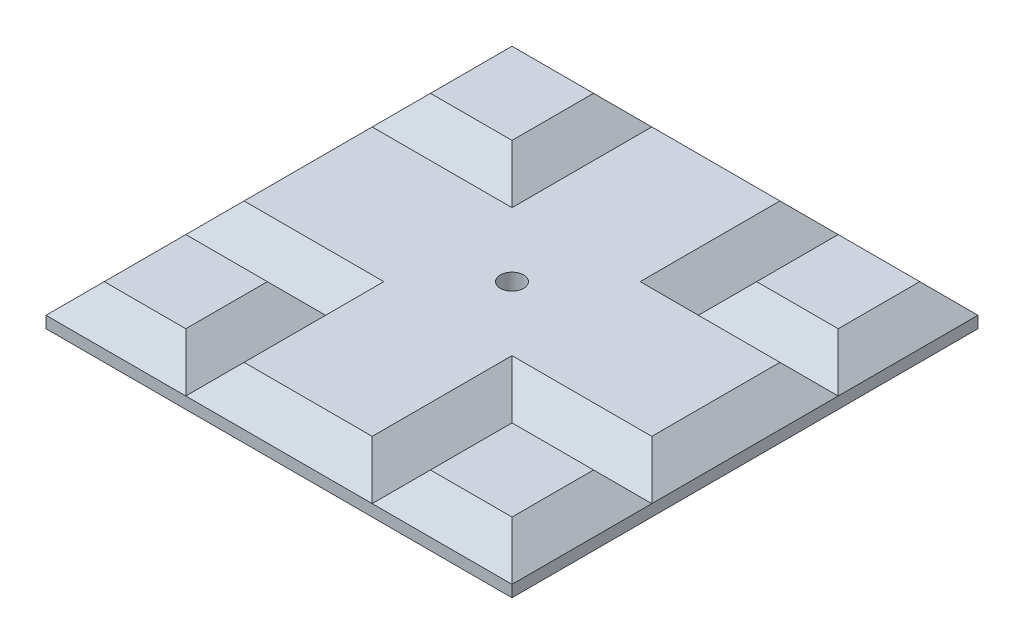
from build123d import *

# Parameters (mm, degrees)
SKETCH1_W           = 40
SKETCH1_H           = 40
BOSS_EXTRUDE1_DEPTH = 6
SKETCH2_W           = 12
SKETCH2_H           = 12
CUT_EXTRUDE1_DEPTH  = 2.5
SKETCH3_W           = 12
SKETCH3_H           = 12
CUT_EXTRUDE2_DEPTH  = 2.5
CHAMFER1_SIZE       = 2.5
SKETCH4_W           = 12
SKETCH4_H           = 12
BOSS_EXTRUDE2_DEPTH = 2.5
SKETCH5_W           = 12
SKETCH5_H           = 12
BOSS_EXTRUDE3_DEPTH = 2.5
CHAMFER2_SIZE       = 2.5
SKETCH6_R           = 2.5
CUT_EXTRUDE3_DEPTH  = 2.5
SKETCH7_R           = 1
CUT_EXTRUDE4_DEPTH  = 29.91366459


# Some blends are built 0.0001 mm under size
with BuildPart() as part:
    # Sketch1 → Boss-Extrude1 (new body)
    with BuildSketch(Plane(origin=(0, 0, 0), x_dir=(1, 0, 0), z_dir=(0, 1, 0))):
        Rectangle(SKETCH1_W, SKETCH1_H)
    extrude(amount=BOSS_EXTRUDE1_DEPTH)

    # Sketch2 → Cut-Extrude1 (cut)
    with BuildSketch(Plane.XZ):
        with Locations((14, 14)):
            Rectangle(SKETCH2_W, SKETCH2_H)
        with Locations((-14, 14)):
            Rectangle(SKETCH2_W, SKETCH2_H)
        with Locations((14, -14)):
            Rectangle(SKETCH2_W, SKETCH2_H)
        with Locations((-14, -14)):
            Rectangle(SKETCH2_W, SKETCH2_H)
    extrude(amount=-CUT_EXTRUDE1_DEPTH, mode=Mode.SUBTRACT)

    # Sketch3 → Cut-Extrude2 (cut)
    with BuildSketch(Plane(origin=(0, 6, 0), x_dir=(1, 0, 0), z_dir=(0, 1, 0))):
        with Locations((14, 14)):
            Rectangle(SKETCH3_W, SKETCH3_H)
        with Locations((-14, 14)):
            Rectangle(SKETCH3_W, SKETCH3_H)
        with Locations((14, -14)):
            Rectangle(SKETCH3_W, SKETCH3_H)
        with Locations((-14, -14)):
            Rectangle(SKETCH3_W, SKETCH3_H)
    extrude(amount=-CUT_EXTRUDE2_DEPTH, mode=Mode.SUBTRACT)

    # Chamfer1
    chamfer1_edges = [part.edges().sort_by_distance(p)[0] for p in [
        (-14, 6, -8),
        (-8, 6, -14),
        (0, 6, -20),
        (8, 6, -14),
        (14, 6, -8),
        (20, 6, 0),
        (14, 6, 8),
        (8, 6, 14),
        (0, 6, 20),
        (-8, 6, 14),
        (-14, 6, 8),
        (-20, 6, 0),
        (-20, 0, 0),
        (-14, 0, 8),
        (-8, 0, 14),
        (0, 0, 20),
        (8, 0, 14),
        (14, 0, 8),
        (20, 0, 0),
        (14, 0, -8),
        (8, 0, -14),
        (0, 0, -20),
        (-8, 0, -14),
        (-14, 0, -8),
    ]]
    chamfer(chamfer1_edges, length=CHAMFER1_SIZE - 0.0001)  # a hair under: the kernel refuses the full size

    # Sketch4 → Boss-Extrude2 (add)
    with BuildSketch(Plane.XZ.offset(-2.5)):
        with Locations((14, -14)):
            Rectangle(SKETCH4_W, SKETCH4_H)
        with Locations((14, 14)):
            Rectangle(SKETCH4_W, SKETCH4_H)
        with Locations((-14, -14)):
            Rectangle(SKETCH4_W, SKETCH4_H)
        with Locations((-14, 14)):
            Rectangle(SKETCH4_W, SKETCH4_H)
    extrude(amount=BOSS_EXTRUDE2_DEPTH)

    # Sketch5 → Boss-Extrude3 (add)
    with BuildSketch(Plane(origin=(0, 3.5, 0), x_dir=(1, 0, 0), z_dir=(0, 1, 0))):
        with Locations((-14, -14)):
            Rectangle(SKETCH5_W, SKETCH5_H)
        with Locations((14, -14)):
            Rectangle(SKETCH5_W, SKETCH5_H)
        with Locations((-14, 14)):
            Rectangle(SKETCH5_W, SKETCH5_H)
        with Locations((14, 14)):
            Rectangle(SKETCH5_W, SKETCH5_H)
    extrude(amount=BOSS_EXTRUDE3_DEPTH)

    # Chamfer2
    # the kernel refuses this chamfer: 2.5 mm, written as the material it takes off along each edge
    with BuildSketch(Plane(origin=(8, 6, 8), x_dir=(0, -0.9996219169112968, -0.027495876610586317), z_dir=(1, 0, 0)), Plane(origin=(-26.42920747, 0, -8), x_dir=(0, 0.9996219169112968, 0.027495876610586317), z_dir=(1, 0, 0)), Plane(origin=(-8, 0, 8), x_dir=(0, 0.9996219169112968, -0.027495876610586317), z_dir=(-1, 0, 0)), Plane(origin=(-26.42920747, 6, -8), x_dir=(6.9547671466025935e-15, 0.027495876610586317, -0.9996219169112968), z_dir=(1, 0, 0))) as chamfer2_piece_1:
        Polygon((CHAMFER2_SIZE * 0.999621916911, -CHAMFER2_SIZE * 0.0274958766106), (-CHAMFER2_SIZE * 0.0274958766106, -CHAMFER2_SIZE * 0.999621916911), (0, 0), align=None)
    extrude(amount=18.42920747, mode=Mode.SUBTRACT)
    with BuildSketch(Plane(origin=(20, 6, 1.57079253), x_dir=(0.027495876610586317, -0.9996219169112968, -1.2780451150309794e-15), z_dir=(0, 0, 1)), Plane(origin=(26.42920747, 6, 20), x_dir=(0, -0.9996219169112968, 0.027495876610586317), z_dir=(-1, 0, 0)), Plane(origin=(-20, 0, 1.57079253), x_dir=(-0.027495876610586317, 0.9996219169112968, 0), z_dir=(0, 0, 1)), Plane(origin=(-26.42920747, 0, 20), x_dir=(0, 0.9996219169112968, 0.027495876610586317), z_dir=(1, 0, 0)), Plane(origin=(20, 0, 1.57079253), x_dir=(-0.9996219169112968, -0.027495876610586372, 0), z_dir=(0, 0, 1)), Plane(origin=(26.42920747, 0, -20), x_dir=(0, 0.9996219169112968, -0.027495876610586317), z_dir=(-1, 0, 0)), Plane(origin=(20, 6, -1.57079253), x_dir=(-0.9996219169112968, 0.027495876610586317, -1.0358163835365089e-14), z_dir=(0, 0, -1)), Plane(origin=(-20, 6, -26.42920747), x_dir=(0.9996219169112968, 0.027495876610586317, -3.936102257438915e-14), z_dir=(0, 0, 1)), Plane(origin=(-20, 6, 1.57079253), x_dir=(0.9996219169112968, 0.027495876610586317, 3.5513704578394593e-15), z_dir=(0, 0, 1))) as chamfer2_piece_2:
        Polygon((CHAMFER2_SIZE * 0.999621916911, -CHAMFER2_SIZE * 0.0274958766106), (-CHAMFER2_SIZE * 0.0274958766106, -CHAMFER2_SIZE * 0.999621916911), (0, 0), align=None)
    extrude(amount=24.85841494, mode=Mode.SUBTRACT)
    with BuildSketch(Plane(origin=(8, 6, 26.42920747), x_dir=(0.9996219169112968, 0.027495876610586317, 0), z_dir=(0, 0, -1)), Plane(origin=(-8, 0, -8), x_dir=(-0.9996219169112968, -0.02749587661058636, 0), z_dir=(0, 0, -1)), Plane(origin=(-8, 0, 26.42920747), x_dir=(-0.9996219169112968, -0.027495876610586372, 0), z_dir=(0, 0, -1)), Plane(origin=(8, 0, 26.42920747), x_dir=(-0.027495876610586317, 0.9996219169112968, 0), z_dir=(0, 0, -1)), Plane(origin=(8, 0, -8), x_dir=(0, -0.027495876610586372, -0.9996219169112968), z_dir=(1, 0, 0)), Plane(origin=(8, 0, -26.42920747), x_dir=(0.9996219169112968, -0.027495876610586372, 0), z_dir=(0, 0, 1)), Plane(origin=(8, 6, -8), x_dir=(0, -0.9996219169112968, 0.027495876610586317), z_dir=(1, 0, 0)), Plane(origin=(8, 6, -26.42920747), x_dir=(-0.027495876610586317, -0.9996219169112968, 0), z_dir=(0, 0, 1)), Plane(origin=(-8, 6, 8), x_dir=(0, -0.9996219169112968, -0.027495876610586317), z_dir=(-1, 0, 0)), Plane(origin=(-8, 6, 26.42920747), x_dir=(0.027495876610586317, -0.9996219169112968, 0), z_dir=(0, 0, -1))) as chamfer2_piece_3:
        Polygon((CHAMFER2_SIZE * 0.999621916911, CHAMFER2_SIZE * 0.0274958766106), (-CHAMFER2_SIZE * 0.0274958766106, CHAMFER2_SIZE * 0.999621916911), (0, 0), align=None)
    extrude(amount=18.42920747, mode=Mode.SUBTRACT)
    with BuildSketch(Plane(origin=(-1.57079253, 0, -20), x_dir=(0, -0.027495876610586372, 0.9996219169112968), z_dir=(-1, 0, 0)), Plane(origin=(-20, 0, -26.42920747), x_dir=(0.9996219169112968, -0.027495876610586372, -6.510845839372511e-15), z_dir=(0, 0, 1)), Plane(origin=(26.42920747, 0, 20), x_dir=(0, 0.9996219169112968, 0.027495876610586317), z_dir=(-1, 0, 0)), Plane(origin=(20, 0, -1.57079253), x_dir=(-0.9996219169112968, -0.027495876610586372, 0), z_dir=(0, 0, -1)), Plane(origin=(26.42920747, 6, -20), x_dir=(0, -0.9996219169112968, -0.027495876610586317), z_dir=(-1, 0, 0)), Plane(origin=(-1.57079253, 6, -20), x_dir=(0, -0.9996219169112968, -0.027495876610586317), z_dir=(-1, 0, 0)), Plane(origin=(-26.42920747, 6, 20), x_dir=(1.1722197233405161e-15, -0.9996219169112968, 0.027495876610586317), z_dir=(1, 0, 0))) as chamfer2_piece_4:
        Polygon((CHAMFER2_SIZE * 0.999621916911, CHAMFER2_SIZE * 0.0274958766106), (-CHAMFER2_SIZE * 0.0274958766106, CHAMFER2_SIZE * 0.999621916911), (0, 0), align=None)
    extrude(amount=24.85841494, mode=Mode.SUBTRACT)
    with BuildSketch(Plane(origin=(1.57079253, 0, 8), x_dir=(0, 0.9996219169112968, -0.027495876610586317), z_dir=(1, 0, 0))) as chamfer2_piece_5_section:
        Polygon((CHAMFER2_SIZE * 0.999621916911, CHAMFER2_SIZE * 0.0274958766106), (-CHAMFER2_SIZE * 0.0274958766106, CHAMFER2_SIZE * 0.999621916911), (0, 0), align=None)
    chamfer2_piece_5 = extrude(amount=24.85841494, mode=Mode.PRIVATE)
    chamfer2_piece_5 = split(chamfer2_piece_5, bisect_by=Plane(origin=(9.775276368, 4.275176368, 8.816532421), z_dir=(0.7071067811865475, -0.7071067811865476, -2.3845673236902997e-15)), keep=Keep.TOP, mode=Mode.PRIVATE)
    add(chamfer2_piece_5, mode=Mode.SUBTRACT)
    with BuildSketch(Plane(origin=(-8, 6, -1.57079253), x_dir=(-0.9996219169112968, 0.027495876610586317, -7.028754031140922e-15), z_dir=(0, 0, -1))) as chamfer2_piece_6_section:
        Polygon((CHAMFER2_SIZE * 0.999621916911, -CHAMFER2_SIZE * 0.0274958766106), (-CHAMFER2_SIZE * 0.0274958766106, -CHAMFER2_SIZE * 0.999621916911), (0, 0), align=None)
    chamfer2_piece_6 = extrude(amount=24.85841494, mode=Mode.PRIVATE)
    chamfer2_piece_6 = split(chamfer2_piece_6, bisect_by=Plane(origin=(-8.816532421, 1.724823632, -9.775276368), z_dir=(0, 0.7071067811865476, -0.7071067811865475)), keep=Keep.TOP, mode=Mode.PRIVATE)
    add(chamfer2_piece_6, mode=Mode.SUBTRACT)

    # Sketch6 → Cut-Extrude3 (cut)
    with BuildSketch(Plane.XZ):
        with Locations(Location((14, 14, 0), (0, 0, 270))):
            Circle(SKETCH6_R)
        with Locations(Location((14, -14, 0), (0, 0, 270))):
            Circle(SKETCH6_R)
        with Locations(Location((-14, -14, 0), (0, 0, 270))):
            Circle(SKETCH6_R)
        with Locations(Location((-14, 14, 0), (0, 0, 270))):
            Circle(SKETCH6_R)
    extrude(amount=-CUT_EXTRUDE3_DEPTH, mode=Mode.SUBTRACT)

    # Sketch7 → Cut-Extrude4 (cut, through all)
    with BuildSketch(Plane(origin=(0, 6, 0), x_dir=(1, 0, 0), z_dir=(0, 1, 0))):
        with Locations(Location((0, 0, 0), (0, 0, 270))):
            Circle(SKETCH7_R)
    extrude(amount=-CUT_EXTRUDE4_DEPTH, mode=Mode.SUBTRACT)


solid = part.part
